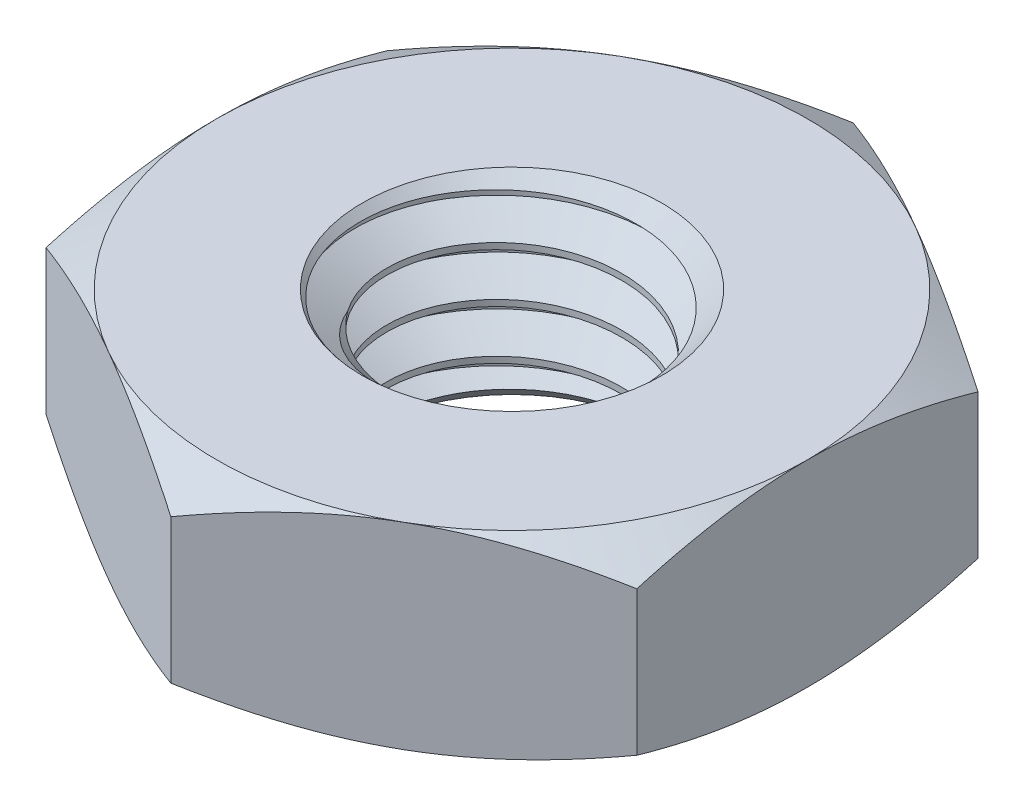
from build123d import *

# Parameters (mm, degrees)
SKETCH1_R               = 2.413
BOSS_EXTRUDE1_DEPTH     = 1.5875
SKETCH5_OUTSIDE_W       = 45.464
SKETCH5_OUTSIDE_H       = 46.936
SKETCH5_OUTSIDE_R       = 4.7625
CUT_EXTRUDE2_DEPTH      = 8.9375
CUT_EXTRUDE2_DRAFT      = -60
MIRROR1_COPY_1_SKETCH_W = 45.464
MIRROR1_COPY_1_SKETCH_H = 46.936
MIRROR1_COPY_1_SKETCH_R = 4.7625
MIRROR1_COPY_1_DEPTH    = 8.9375
MIRROR1_COPY_1_DRAFT    = -60
SKETCH8_R               = 2.413
BOSS_EXTRUDE2_DEPTH     = 3.175
BOSS_EXTRUDE3_START     = -3.175
SKETCH9_R               = 2.413
BOSS_EXTRUDE3_DEPTH     = 3.175
CUT_SWEEP1_PITCH        = 0.79375


with BuildPart() as part:
    # Sketch1 → Boss-Extrude1 (new, symmetric)
    with BuildSketch(Plane(origin=(0, 0, 0), x_dir=(1, 0, 0), z_dir=(0, 1, 0))):
        Polygon((-4.7625, 2.749630657), (-4.7625, -2.749630657), (0, -5.499261314), (4.7625, -2.749630657), (4.7625, 2.749630657), (0, 5.499261314), align=None)
        with Locations(Location((0, 0, 0), (0, 0, 270))):
            Circle(SKETCH1_R, mode=Mode.SUBTRACT)
    extrude(amount=BOSS_EXTRUDE1_DEPTH, both=True)


with BuildPart() as cut_extrude2_tool:
    # Sketch5 outside → Cut-Extrude2 (with draft: the straight prism first)
    with BuildSketch(Plane(origin=(0, 1.5875, 0), x_dir=(1, 0, 0), z_dir=(0, 1, 0))):
        Rectangle(SKETCH5_OUTSIDE_W, SKETCH5_OUTSIDE_H)
        Circle(SKETCH5_OUTSIDE_R, mode=Mode.SUBTRACT)
    extrude(amount=-CUT_EXTRUDE2_DEPTH)
    # Cut-Extrude2: the draft: its side faces are tilted about the plane it starts from
    cut_extrude2_sides = [cut_extrude2_tool.faces().sort_by_distance(p)[0] for p in [
        (0, -2.88125, 23.468),
        (22.732, -2.88125, 0),
        (0, -2.88125, -23.468),
        (-22.732, -2.88125, 0),
        (-4.7625, -2.88125, 0),
    ]]
    draft(cut_extrude2_sides, Plane(origin=(0, 1.5875, 0), x_dir=(1, 0, 0), z_dir=(0, 1, 0)), CUT_EXTRUDE2_DRAFT)


with BuildPart() as part_1:
    add(part.part)

    # Cut-Extrude2: cut by cut_extrude2_tool
    add(cut_extrude2_tool.part, mode=Mode.SUBTRACT)


with BuildPart() as mirror1_copy_1_tool:
    # Mirror1 copy 1 sketch → Mirror1 copy 1 (with draft: the straight prism first)
    with BuildSketch(Plane.XZ.offset(1.5875)):
        Rectangle(MIRROR1_COPY_1_SKETCH_W, MIRROR1_COPY_1_SKETCH_H)
        Circle(MIRROR1_COPY_1_SKETCH_R, mode=Mode.SUBTRACT)
    extrude(amount=-MIRROR1_COPY_1_DEPTH)
    # Mirror1 copy 1: the draft: its side faces are tilted about the plane it starts from
    mirror1_copy_1_sides = [mirror1_copy_1_tool.faces().sort_by_distance(p)[0] for p in [
        (0, 2.88125, 23.468),
        (22.732, 2.88125, 0),
        (0, 2.88125, -23.468),
        (-22.732, 2.88125, 0),
        (-4.7625, 2.88125, 0),
    ]]
    draft(mirror1_copy_1_sides, Plane.XZ.offset(1.5875), MIRROR1_COPY_1_DRAFT)


with BuildPart() as part_2:
    add(part_1.part)

    # Mirror1 copy 1: cut by mirror1_copy_1_tool
    add(mirror1_copy_1_tool.part, mode=Mode.SUBTRACT)

    # Sketch9 → Boss-Extrude3 (add)
    with BuildSketch(Plane(origin=(0, 1.5875, 0), x_dir=(1, 0, 0), z_dir=(0, 1, 0)).offset(BOSS_EXTRUDE3_START)):
        with Locations(Location((0, 0, 0), (0, 0, 270))):
            Circle(SKETCH9_R)
    extrude(amount=BOSS_EXTRUDE3_DEPTH)


with BuildPart() as body_2:
    # Sketch8 → Boss-Extrude2 (new body)
    with BuildSketch(Plane(origin=(0, 1.5875, 0), x_dir=(1, 0, 0), z_dir=(0, 1, 0))):
        with Locations(Location((0, 0, 0), (0, 0, 270))):
            Circle(SKETCH8_R)
    extrude(amount=-BOSS_EXTRUDE2_DEPTH)

    # Cut-Sweep1: the profile of Sketch11 profile screwed along a right-hand helix of 5 turns, 8 arcs to a turn; built about Z, then put on its axis
    cut_sweep1_z = Axis((0, 0, 0), (0, 0, 1))
    cut_sweep1_corners = [(2.4133, 0, 0.000173205), (2.4133, 0, -0.694704455), (1.897444252, 0, -0.396875), (1.897444252, 0, -0.29765625)]
    with BuildLine(mode=Mode.PRIVATE) as cut_sweep1_profile:
        Line(cut_sweep1_corners[0], cut_sweep1_corners[1])
        Line(cut_sweep1_corners[1], cut_sweep1_corners[2])
        Line(cut_sweep1_corners[2], cut_sweep1_corners[3])
        Line(cut_sweep1_corners[3], cut_sweep1_corners[0])
    cut_sweep1_cap = Face(cut_sweep1_profile.wire())
    cut_sweep1_turn_angles = [0, 22.5, 45, 67.5, 90, 112.5, 135, 157.5, 180, 202.5, 225, 247.5, 270, 292.5, 315, 337.5, 360]
    cut_sweep1_turn_weights = [1, 0.9238795325112867, 1, 0.9238795325112867, 1, 0.9238795325112867, 1, 0.9238795325112867, 1, 0.9238795325112867, 1, 0.9238795325112867, 1, 0.9238795325112867, 1, 0.9238795325112867, 1]
    cut_sweep1_turn_rails = [Edge.make_bspline([Vector(p[0], p[1], 0).rotate(cut_sweep1_z, cut_sweep1_turn_angles[k]) / cut_sweep1_turn_weights[k] + Vector(0, 0, p[2] + CUT_SWEEP1_PITCH * cut_sweep1_turn_angles[k] / 360) for k in range(17)], [0, 0, 0, 1, 1, 2, 2, 3, 3, 4, 4, 5, 5, 6, 6, 7, 7, 8, 8, 8], 2, cut_sweep1_turn_weights) for p in cut_sweep1_corners]
    cut_sweep1_turn_sides = [Face.make_surface_from_curves(cut_sweep1_turn_rails[p[0]], cut_sweep1_turn_rails[p[1]]) for p in [(0, 1), (1, 2), (2, 3), (3, 0)]]
    cut_sweep1 = Plane(origin=(0, 1.5875, 0), x_dir=(0, 0, 1), z_dir=(0, -1, 0)) * Solid(Shell([*[p.moved(Location((0, 0, CUT_SWEEP1_PITCH * i))) for i in range(5) for p in cut_sweep1_turn_sides], cut_sweep1_cap, cut_sweep1_cap.rotate(cut_sweep1_z, 1800).moved(Location((0, 0, CUT_SWEEP1_PITCH * 1800 / 360)))]))
    add(cut_sweep1, mode=Mode.SUBTRACT)


with BuildPart() as part_3:
    add(part_2.part)

    # Combine1: cut body 2
    add(body_2.part, mode=Mode.SUBTRACT)

    # Cut-Extrude3 cone 1 section (through the dimple's axis) → Cut-Extrude3 (revolve, cut)
    with BuildSketch(Plane(origin=(0, 1.5875, 0), x_dir=(0, 0, 1), z_dir=(1, 0, 0))):
        Polygon((0, 0), (2.413, 0), (0, 2.413), align=None)
    revolve(axis=Axis((0, 1.5875, 0), (0, -1, 0)), mode=Mode.SUBTRACT)

    # Cut-Extrude4 cone 1 section (through the dimple's axis) → Cut-Extrude4 (revolve, cut)
    with BuildSketch(Plane(origin=(0, -1.5875, 0), x_dir=(0, 0, -1), z_dir=(1, 0, 0))):
        Polygon((0, 0), (2.413, 0), (0, 2.413), align=None)
    revolve(axis=Axis((0, -1.5875, 0), (0, 1, 0)), mode=Mode.SUBTRACT)


solid = part_3.part
